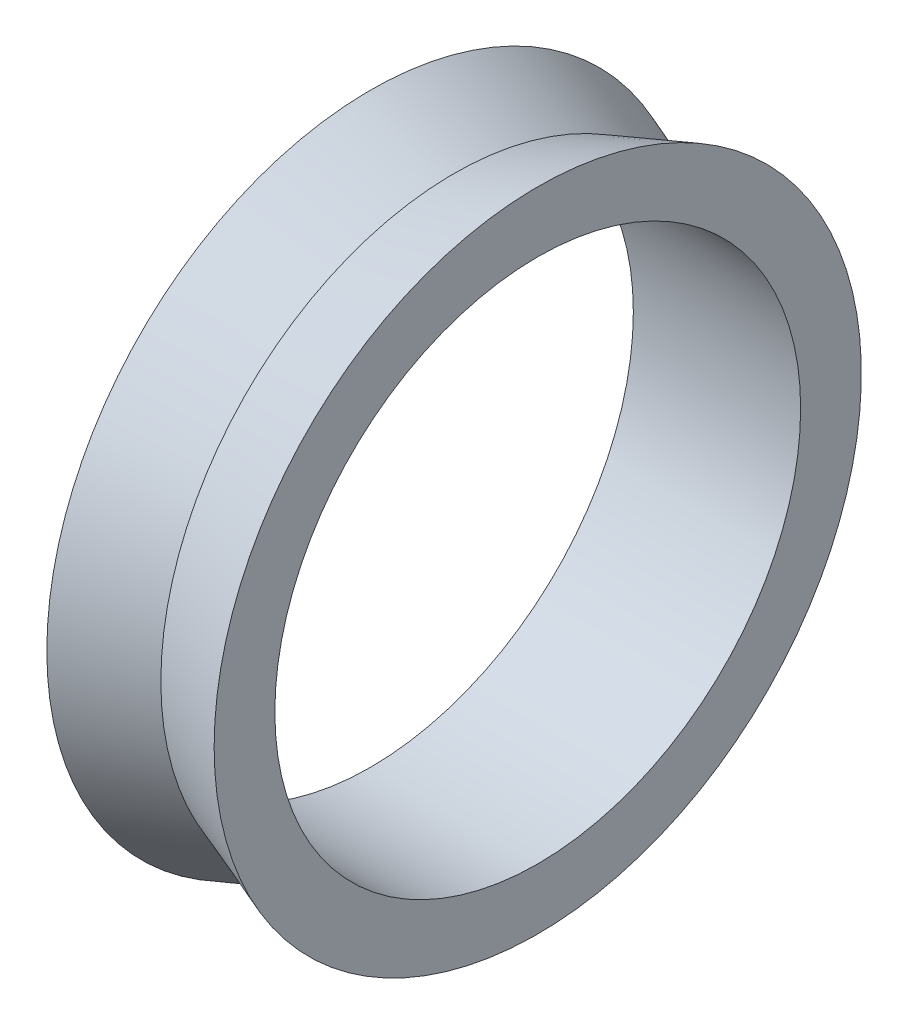
from build123d import *


with BuildPart() as part:
    # Sketch1 → Revolve1 (revolve)
    with BuildSketch(Plane.XY):
        Polygon((-3.5, 13.54), (-3.5, 11), (3.5, 11), (3.5, 13.54), (0, 12.27), align=None)
    revolve(axis=Axis((0, 0, 0), (1, 0, 0)))


solid = part.part
